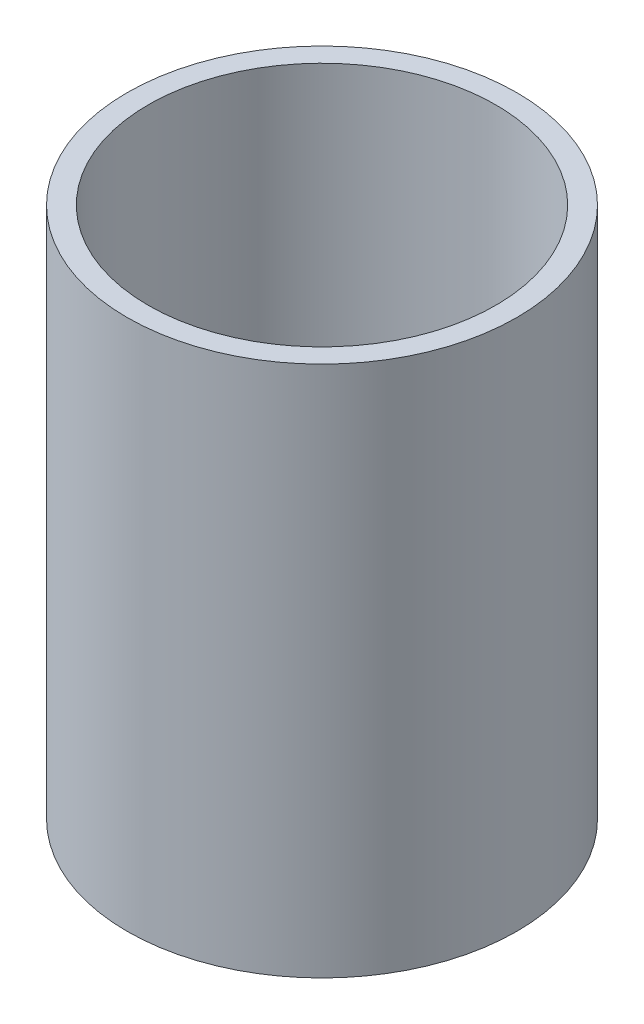
from build123d import *

# Parameters (mm, degrees)
SKETCH1_R           = 57.5
BOSS_EXTRUDE1_DEPTH = 156.911858605
SKETCH2_R           = 51.281596594
CUT_EXTRUDE1_DEPTH  = 177.73095759


with BuildPart() as part:
    # Sketch1 → Boss-Extrude1 (new body)
    with BuildSketch(Plane(origin=(0, 0, 0), x_dir=(1, 0, 0), z_dir=(0, 1, 0))):
        Circle(SKETCH1_R)
    extrude(amount=BOSS_EXTRUDE1_DEPTH)

    # Sketch2 → Cut-Extrude1 (cut, through all)
    with BuildSketch(Plane(origin=(0, 0, 0), x_dir=(1, 0, 0), z_dir=(0, 1, 0))):
        Circle(SKETCH2_R)
    extrude(amount=CUT_EXTRUDE1_DEPTH, mode=Mode.SUBTRACT)


solid = part.part
